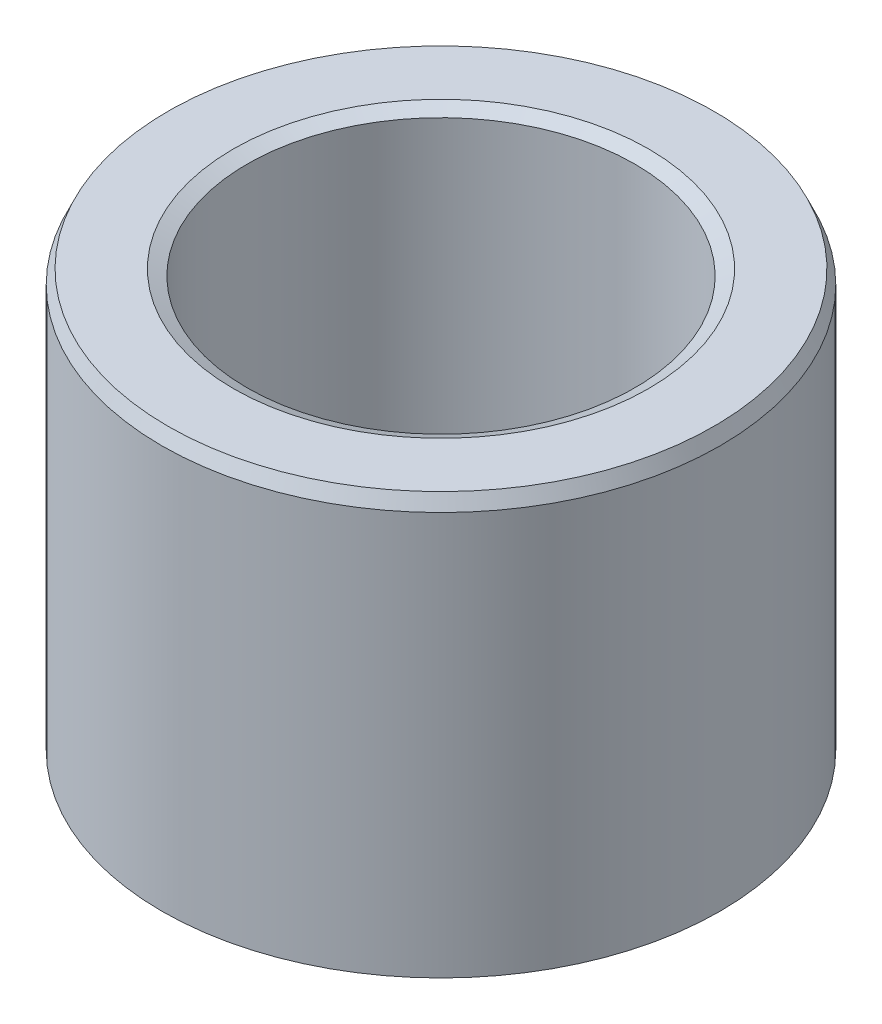
from build123d import *
from OCP.BRepFilletAPI import BRepFilletAPI_MakeChamfer

# Parameters (mm, degrees)
SKETCH1_R           = 10
BOSS_EXTRUDE1_DEPTH = 15.154461226
SKETCH2_R           = 6.944759278
CUT_EXTRUDE1_DEPTH  = 21.728186005
CHAMFER1_SIZE       = 0.492545443
CHAMFER1_SIZE2      = 0.223008603


with BuildPart() as part:
    # Sketch1 → Boss-Extrude1 (new body)
    with BuildSketch(Plane(origin=(0, 0, 0), x_dir=(1, 0, 0), z_dir=(0, 1, 0))):
        Circle(SKETCH1_R)
    extrude(amount=BOSS_EXTRUDE1_DEPTH)

    # Sketch2 → Cut-Extrude1 (cut, through all)
    with BuildSketch(Plane(origin=(0, 0, 0), x_dir=(1, 0, 0), z_dir=(0, 1, 0))):
        Circle(SKETCH2_R)
    extrude(amount=CUT_EXTRUDE1_DEPTH, mode=Mode.SUBTRACT)

    # Chamfer1: one chamfer whose edges measure the first distance from different faces: ONE call of the kernel's chamfer builder (chamfer() names one face for all edges)
    chamfer1_edges_1 = [part.edges().sort_by_distance(p)[0] for p in [
        (-6.944759278, 15.154461226, 0),
    ]]
    chamfer1_side_1 = [part.faces().sort_by_distance(p)[0] for p in [
        (-9.717157288, 15.154461226, 0),
    ]]
    chamfer1_edges_2 = [part.edges().sort_by_distance(p)[0] for p in [
        (-6.944759278, 0, 0),
    ]]
    chamfer1_side_2 = [part.faces().sort_by_distance(p)[0] for p in [
        (-6.944759278, 7.577230613, 0),
    ]]
    chamfer1_edges_3 = [part.edges().sort_by_distance(p)[0] for p in [
        (-10, 0, 0),
    ]]
    chamfer1_side_3 = [part.faces().sort_by_distance(p)[0] for p in [
        (-9.717157288, 0, 0),
    ]]
    chamfer1_edges_4 = [part.edges().sort_by_distance(p)[0] for p in [
        (-10, 15.154461226, 0),
    ]]
    chamfer1_side_4 = [part.faces().sort_by_distance(p)[0] for p in [
        (-10, 7.577230613, 0),
    ]]
    chamfer1 = BRepFilletAPI_MakeChamfer(part.part.solid().wrapped)
    for e in chamfer1_edges_1:
        chamfer1.Add(CHAMFER1_SIZE, CHAMFER1_SIZE2, e.wrapped, chamfer1_side_1[0].wrapped)  # the first distance lies on this face
    for e in chamfer1_edges_2:
        chamfer1.Add(CHAMFER1_SIZE, CHAMFER1_SIZE2, e.wrapped, chamfer1_side_2[0].wrapped)  # the first distance lies on this face
    for e in chamfer1_edges_3:
        chamfer1.Add(CHAMFER1_SIZE, CHAMFER1_SIZE2, e.wrapped, chamfer1_side_3[0].wrapped)  # the first distance lies on this face
    for e in chamfer1_edges_4:
        chamfer1.Add(CHAMFER1_SIZE, CHAMFER1_SIZE2, e.wrapped, chamfer1_side_4[0].wrapped)  # the first distance lies on this face
    add(Compound.cast(chamfer1.Shape()), mode=Mode.REPLACE)


solid = part.part
